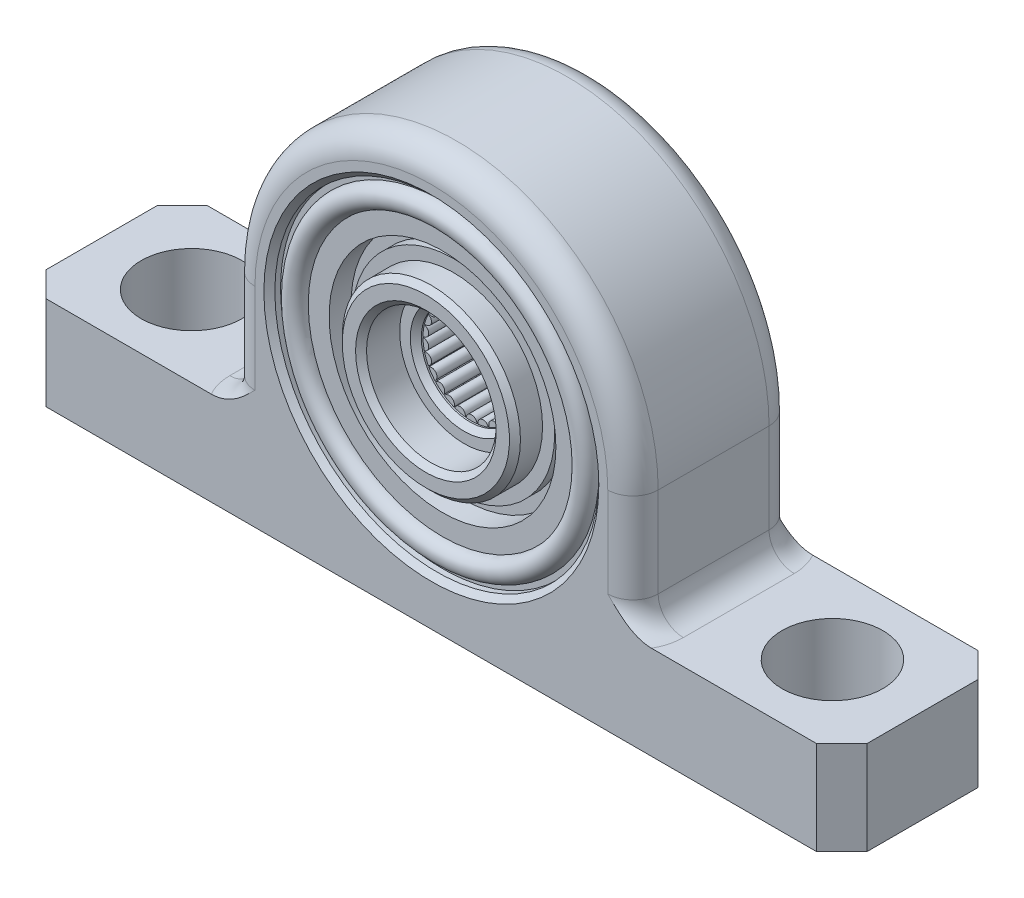
from build123d import *

# Parameters (mm, degrees)
SKETCH8_R                = 3.375
CUT_EXTRUDE2_DEPTH       = 19.573921704
SKETCH9_R                = 0.375
BOSS_EXTRUDE2_DEPTH      = 2.806882143
CIRPATTERN1_COUNT        = 26
CHAMFER2_SIZE            = 0.381
BOSS_EXTRUDE1_DEPTH      = 5.6
BOSS_EXTRUDE1_DEPTH_BACK = 5.6
SKETCH4_R                = 11.25
SKETCH5_R                = 3.5
CUT_EXTRUDE1_DEPTH       = 37.496881524
CHAMFER1_SIZE            = 1.74
FILLET1_R                = 1.75
FILLET3_R                = 1.75
CHAMFER3_SIZE            = 0.381


with BuildPart() as part:
    # Sketch6 → Revolve1 (revolve)
    with BuildSketch(Plane(origin=(0, 0, 0), x_dir=(0, 0, -1), z_dir=(1, 0, 0)), mode=Mode.PRIVATE) as revolve1_sk:
        with BuildLine():
            Line((-4.826214286, 11.119), (-4.826214286, 11.5))
            Line((-4.826214286, 11.5), (4.826214286, 11.5))
            Line((4.826214286, 11.5), (4.826214286, 11.119))
            ThreePointArc((4.826214286, 11.119), (5.6, 10.345214286), (4.826214286, 9.571428571))
            Line((4.826214286, 9.571428571), (4.826214286, 8.125))
            Line((4.826214286, 8.125), (3.302214286, 8.125))
            Line((3.302214286, 8.125), (3.302214286, 7.28125))
            Line((3.302214286, 7.28125), (4.064214286, 7.28125))
            Line((4.064214286, 7.28125), (4.064214286, 6.4375))
            Line((4.064214286, 6.4375), (5.981, 6.4375))
            Line((5.981, 6.4375), (5.981, 4.75))
            Line((5.981, 4.75), (3.302214286, 4.75))
            Line((3.302214286, 4.75), (3.302214286, 3.25))
            Line((3.302214286, 3.25), (-3.302214286, 3.25))
            Line((-3.302214286, 3.25), (-3.302214286, 4.75))
            Line((-3.302214286, 4.75), (-5.981, 4.75))
            Line((-5.981, 4.75), (-5.981, 6.4375))
            Line((-5.981, 6.4375), (-4.064214286, 6.4375))
            Line((-4.064214286, 6.4375), (-4.064214286, 7.28125))
            Line((-4.064214286, 7.28125), (-3.302214286, 7.28125))
            Line((-3.302214286, 7.28125), (-3.302214286, 8.125))
            Line((-3.302214286, 8.125), (-4.826214286, 8.125))
            Line((-4.826214286, 8.125), (-4.826214286, 9.571428571))
            ThreePointArc((-4.826214286, 9.571428571), (-5.6, 10.345214286), (-4.826214286, 11.119))
        make_face()
    revolve(revolve1_sk.sketch.rotate(Axis((0, 0.25, 5.6), (0, 0, -1)), 90), axis=Axis((0, 0.25, 5.6), (0, 0, -1)))

    # Sketch8 → Cut-Extrude2 (cut, through all)
    with BuildSketch(Plane.XY.offset(3.302214286)):
        with Locations((0, 0.25)):
            Circle(SKETCH8_R)
    extrude(amount=-CUT_EXTRUDE2_DEPTH, mode=Mode.SUBTRACT)

    # Sketch9 → Boss-Extrude2 (add, symmetric)
    with BuildSketch(Plane.XY):
        with Locations((0, 3.625)):
            Circle(SKETCH9_R)
    boss_extrude2 = extrude(amount=BOSS_EXTRUDE2_DEPTH, both=True)

    # CirPattern1: Boss-Extrude2 ×26 about axis
    cirpattern1_axis = Axis((0, 0.25, 0), (0, 0, 1))
    for i in range(1, CIRPATTERN1_COUNT):
        add(boss_extrude2.rotate(cirpattern1_axis, i * 360 / CIRPATTERN1_COUNT))

    # Chamfer2
    chamfer2_edges = [part.edges().sort_by_distance(p)[0] for p in [
        (-6.1875, 0.25, -5.981),
        (-4.5, 0.25, -5.981),
        (-4.5, 0.25, 5.981),
        (-6.1875, 0.25, 5.981),
        (-3.375, 0.25, 3.302214286),
        (-3.375, 0.25, -3.302214286),
    ]]
    chamfer(chamfer2_edges, length=CHAMFER2_SIZE)


with BuildPart() as body_2:
    # Sketch4 → Boss-Extrude1 (new, two sides: drawn at the far end of the back side and taken through both)
    with BuildSketch(Plane.XY.offset(-BOSS_EXTRUDE1_DEPTH_BACK)):
        with BuildLine():
            Line((-28.5, -14.25), (-28.5, -7.75))
            Line((-28.5, -7.75), (-14, -7.75))
            Line((-14, -7.75), (-14, 0.25))
            ThreePointArc((-14, 0.25), (0, 14.25), (14, 0.25))
            Line((14, 0.25), (14, -7.75))
            Line((14, -7.75), (28.5, -7.75))
            Line((28.5, -7.75), (28.5, -14.25))
            Line((28.5, -14.25), (-28.5, -14.25))
        make_face()
        with Locations((0, 0.25)):
            Circle(SKETCH4_R, mode=Mode.SUBTRACT)
    extrude(amount=BOSS_EXTRUDE1_DEPTH + BOSS_EXTRUDE1_DEPTH_BACK)

    # Sketch5 → Cut-Extrude1 (cut, through all)
    with BuildSketch(Plane(origin=(0, -7.75, 0), x_dir=(1, 0, 0), z_dir=(0, 1, 0))):
        with Locations(Location((-22.25, 0, 0), (0, 0, 270))):
            Circle(SKETCH5_R)
        with Locations(Location((22.25, 0, 0), (0, 0, 270))):
            Circle(SKETCH5_R)
    extrude(amount=-CUT_EXTRUDE1_DEPTH, mode=Mode.SUBTRACT)

    # Chamfer1
    chamfer1_edges = [body_2.edges().sort_by_distance(p)[0] for p in [
        (-28.5, -11, -5.6),
        (-28.5, -11, 5.6),
        (28.5, -11, -5.6),
        (28.5, -11, 5.6),
    ]]
    chamfer(chamfer1_edges, length=CHAMFER1_SIZE)

    # Fillet1
    fillet1_edges = [body_2.edges().sort_by_distance(p)[0] for p in [
        (14, -3.75, 5.6),
        (0, 14.25, 5.6),
        (-14, -3.75, 5.6),
        (-14, -3.75, -5.6),
        (0, 14.25, -5.6),
        (14, -3.75, -5.6),
    ]]
    fillet(fillet1_edges, radius=FILLET1_R)

    # Fillet3
    # the kernel refuses this fillet: 1.75 mm, written as the material it adds along each edge
    with BuildSketch(Plane(origin=(14, -7.75, 3.85), x_dir=(1, 0, 0), z_dir=(0, 0, -1))) as fillet3_piece_1:
        with BuildLine():
            CenterArc((FILLET3_R, -FILLET3_R), FILLET3_R, 90, 90)
            Line((0, -FILLET3_R), (0, 0))
            Line((0, 0), (FILLET3_R, 0))
        make_face()
    extrude(amount=7.7)
    with BuildSketch(Plane(origin=(-14, -7.75, 3.85), x_dir=(-1, 0, 0), z_dir=(0, 0, -1))) as fillet3_piece_2:
        with BuildLine():
            CenterArc((FILLET3_R, FILLET3_R), FILLET3_R, 180, 90)
            Line((0, FILLET3_R), (0, 0))
            Line((0, 0), (FILLET3_R, 0))
        make_face()
    extrude(amount=7.7)
    with BuildSketch(Plane(origin=(12.25, -7.75, -3.85), x_dir=(-0.597667277632827, 0, 0.8017442392976486), z_dir=(0.8017442392976486, 0, 0.597667277632827))) as fillet3_piece_3_section:
        with BuildLine():
            CenterArc((1.75 + FILLET3_R, -FILLET3_R), FILLET3_R, 90, 90)
            Line((1.75, -FILLET3_R), (1.75, 0))
            Line((1.75, 0), (1.75 + FILLET3_R, 0))
        make_face()
    fillet3_piece_3 = revolve(axis=Axis((12.25, -7.75, -3.85), (0, -1, 0)), revolution_arc=233.296989237, mode=Mode.PRIVATE)
    fillet3_piece_3 = split(fillet3_piece_3, bisect_by=Plane(origin=(13.562393046, -7.204650182, -5.6), z_dir=(0, 0, 1)), keep=Keep.TOP, mode=Mode.PRIVATE)
    add(fillet3_piece_3)
    with BuildSketch(Plane(origin=(12.25, -7.75, 3.85), x_dir=(-0.597667277632827, 0, -0.8017442392976486), z_dir=(0.8017442392976486, 0, -0.597667277632827))) as fillet3_piece_4_section:
        with BuildLine():
            CenterArc((1.75 + FILLET3_R, FILLET3_R), FILLET3_R, 180, 90)
            Line((1.75, FILLET3_R), (1.75, 0))
            Line((1.75, 0), (1.75 + FILLET3_R, 0))
        make_face()
    fillet3_piece_4 = revolve(axis=Axis((12.25, -7.75, 3.85), (0, 1, 0)), revolution_arc=233.296989237, mode=Mode.PRIVATE)
    fillet3_piece_4 = split(fillet3_piece_4, bisect_by=Plane(origin=(13.562393046, -7.204650182, 5.6), z_dir=(0, 0, -1)), keep=Keep.TOP, mode=Mode.PRIVATE)
    add(fillet3_piece_4)
    with BuildSketch(Plane(origin=(-12.25, -7.75, -3.85), x_dir=(0.5976672776328273, 0, 0.8017442392976485), z_dir=(-0.8017442392976485, 0, 0.5976672776328273))) as fillet3_piece_5_section:
        with BuildLine():
            CenterArc((1.75 + FILLET3_R, FILLET3_R), FILLET3_R, 180, 90)
            Line((1.75, FILLET3_R), (1.75, 0))
            Line((1.75, 0), (1.75 + FILLET3_R, 0))
        make_face()
    fillet3_piece_5 = revolve(axis=Axis((-12.25, -7.75, -3.85), (0, 1, 0)), revolution_arc=233.296989237, mode=Mode.PRIVATE)
    fillet3_piece_5 = split(fillet3_piece_5, bisect_by=Plane(origin=(-13.562393161, -7.20465046, -5.6), z_dir=(0, 0, 1)), keep=Keep.TOP, mode=Mode.PRIVATE)
    add(fillet3_piece_5)
    with BuildSketch(Plane(origin=(-12.25, -7.75, 3.85), x_dir=(0.5976672776328273, 0, -0.8017442392976485), z_dir=(-0.8017442392976485, 0, -0.5976672776328273))) as fillet3_piece_6_section:
        with BuildLine():
            CenterArc((1.75 + FILLET3_R, -FILLET3_R), FILLET3_R, 90, 90)
            Line((1.75, -FILLET3_R), (1.75, 0))
            Line((1.75, 0), (1.75 + FILLET3_R, 0))
        make_face()
    fillet3_piece_6 = revolve(axis=Axis((-12.25, -7.75, 3.85), (0, -1, 0)), revolution_arc=233.296989237, mode=Mode.PRIVATE)
    fillet3_piece_6 = split(fillet3_piece_6, bisect_by=Plane(origin=(-13.562393161, -7.20465046, 5.6), z_dir=(0, 0, -1)), keep=Keep.TOP, mode=Mode.PRIVATE)
    add(fillet3_piece_6)

    # Chamfer3
    chamfer3_edges = [body_2.edges().sort_by_distance(p)[0] for p in [
        (-11.25, 0.25, 5.6),
        (-11.25, 0.25, -5.6),
    ]]
    chamfer(chamfer3_edges, length=CHAMFER3_SIZE)


solid = Compound([part.part, body_2.part])
